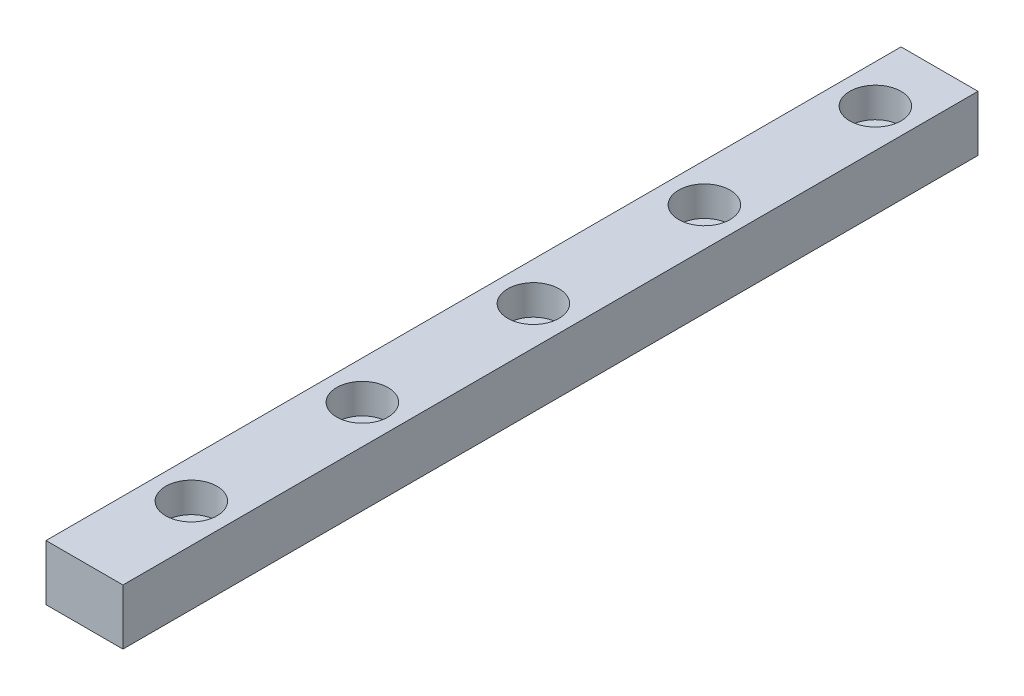
from build123d import *

# Parameters (mm, degrees)
SKETCH_1_W          = 9
SKETCH_1_H          = 6.5
EXTRUDE_1_DEPTH     = 100
SKETCH_2_R          = 1.750000006
CUT_EXTRUDE_1_DEPTH = 90.614230596
SKETCH_3_R          = 3.000000006
CUT_EXTRUDE_2_DEPTH = 3.5


with BuildPart() as part:
    # 草图1 → 凸台-拉伸1 (new body)
    with BuildSketch(Plane.XY.offset(-89.264832522)):
        Rectangle(SKETCH_1_W, SKETCH_1_H)
    extrude(amount=EXTRUDE_1_DEPTH)

    # 草图2 → 切除-拉伸1 (cut, through all)
    with BuildSketch(Plane(origin=(0, 3.25, 0), x_dir=(1, 0, 0), z_dir=(0, 1, 0))):
        with Locations((0, 81.764832522)):
            Circle(SKETCH_2_R)
        with Locations((0, 61.764832522)):
            Circle(SKETCH_2_R)
        with Locations((0, 41.764832522)):
            Circle(SKETCH_2_R)
        with Locations((0, 21.764832522)):
            Circle(SKETCH_2_R)
        with Locations((0, 1.764832522)):
            Circle(SKETCH_2_R)
        with Locations((0, -18.235167478)):
            Circle(SKETCH_2_R)
        with Locations((0, -38.235167478)):
            Circle(SKETCH_2_R)
        with Locations((0, -58.235167478)):
            Circle(SKETCH_2_R)
        with Locations((0, -78.235167478)):
            Circle(SKETCH_2_R)
        with Locations((0, -98.235167478)):
            Circle(SKETCH_2_R)
        with Locations((0, -118.235167478)):
            Circle(SKETCH_2_R)
        with Locations((0, -138.235167478)):
            Circle(SKETCH_2_R)
        with Locations((0, -158.235167478)):
            Circle(SKETCH_2_R)
        with Locations((0, -178.235167478)):
            Circle(SKETCH_2_R)
        with Locations((0, -198.235167478)):
            Circle(SKETCH_2_R)
        with Locations((0, -218.235167478)):
            Circle(SKETCH_2_R)
        with Locations((0, -238.235167478)):
            Circle(SKETCH_2_R)
        with Locations((0, -258.235167478)):
            Circle(SKETCH_2_R)
        with Locations((0, -278.235167478)):
            Circle(SKETCH_2_R)
        with Locations((0, -298.235167478)):
            Circle(SKETCH_2_R)
        with Locations((0, -318.235167478)):
            Circle(SKETCH_2_R)
        with Locations((0, -338.235167478)):
            Circle(SKETCH_2_R)
        with Locations((0, -358.235167478)):
            Circle(SKETCH_2_R)
        with Locations((0, -378.235167478)):
            Circle(SKETCH_2_R)
        with Locations((0, -398.235167478)):
            Circle(SKETCH_2_R)
        with Locations((0, -418.235167478)):
            Circle(SKETCH_2_R)
        with Locations((0, -438.235167478)):
            Circle(SKETCH_2_R)
        with Locations((0, -458.235167478)):
            Circle(SKETCH_2_R)
        with Locations((0, -478.235167478)):
            Circle(SKETCH_2_R)
        with Locations((0, -498.235167478)):
            Circle(SKETCH_2_R)
        with Locations((0, -518.235167478)):
            Circle(SKETCH_2_R)
        with Locations((0, -538.235167478)):
            Circle(SKETCH_2_R)
        with Locations((0, -558.235167478)):
            Circle(SKETCH_2_R)
        with Locations((0, -578.235167478)):
            Circle(SKETCH_2_R)
        with Locations((0, -598.235167478)):
            Circle(SKETCH_2_R)
        with Locations((0, -618.235167478)):
            Circle(SKETCH_2_R)
        with Locations((0, -638.235167478)):
            Circle(SKETCH_2_R)
        with Locations((0, -658.235167478)):
            Circle(SKETCH_2_R)
        with Locations((0, -678.235167478)):
            Circle(SKETCH_2_R)
        with Locations((0, -698.235167478)):
            Circle(SKETCH_2_R)
        with Locations((0, -718.235167478)):
            Circle(SKETCH_2_R)
        with Locations((0, -738.235167478)):
            Circle(SKETCH_2_R)
        with Locations((0, -758.235167478)):
            Circle(SKETCH_2_R)
        with Locations((0, -778.235167478)):
            Circle(SKETCH_2_R)
        with Locations((0, -798.235167478)):
            Circle(SKETCH_2_R)
        with Locations((0, -818.235167478)):
            Circle(SKETCH_2_R)
        with Locations((0, -838.235167478)):
            Circle(SKETCH_2_R)
        with Locations((0, -858.235167478)):
            Circle(SKETCH_2_R)
        with Locations((0, -878.235167478)):
            Circle(SKETCH_2_R)
        with Locations((0, -898.235167478)):
            Circle(SKETCH_2_R)
        with Locations((0, -918.235167478)):
            Circle(SKETCH_2_R)
        with Locations((0, -938.235167478)):
            Circle(SKETCH_2_R)
        with Locations((0, -958.235167478)):
            Circle(SKETCH_2_R)
        with Locations((0, -978.235167478)):
            Circle(SKETCH_2_R)
        with Locations((0, -998.235167478)):
            Circle(SKETCH_2_R)
        with Locations((0, -1018.235167478)):
            Circle(SKETCH_2_R)
        with Locations((0, -1038.235167478)):
            Circle(SKETCH_2_R)
        with Locations((0, -1058.235167478)):
            Circle(SKETCH_2_R)
        with Locations((0, -1078.235167478)):
            Circle(SKETCH_2_R)
        with Locations((0, -1098.235167478)):
            Circle(SKETCH_2_R)
    extrude(amount=-CUT_EXTRUDE_1_DEPTH, mode=Mode.SUBTRACT)

    # 草图3 → 切除-拉伸2 (cut)
    with BuildSketch(Plane(origin=(0, 3.25, 0), x_dir=(1, 0, 0), z_dir=(0, 1, 0))):
        with Locations((0, 81.764832522)):
            Circle(SKETCH_3_R)
        with Locations((0, 61.764832522)):
            Circle(SKETCH_3_R)
        with Locations((0, 41.764832522)):
            Circle(SKETCH_3_R)
        with Locations((0, 21.764832522)):
            Circle(SKETCH_3_R)
        with Locations((0, 1.764832522)):
            Circle(SKETCH_3_R)
        with Locations((0, -18.235167478)):
            Circle(SKETCH_3_R)
        with Locations((0, -38.235167478)):
            Circle(SKETCH_3_R)
        with Locations((0, -58.235167478)):
            Circle(SKETCH_3_R)
        with Locations((0, -78.235167478)):
            Circle(SKETCH_3_R)
        with Locations((0, -98.235167478)):
            Circle(SKETCH_3_R)
        with Locations((0, -118.235167478)):
            Circle(SKETCH_3_R)
        with Locations((0, -138.235167478)):
            Circle(SKETCH_3_R)
        with Locations((0, -158.235167478)):
            Circle(SKETCH_3_R)
        with Locations((0, -178.235167478)):
            Circle(SKETCH_3_R)
        with Locations((0, -198.235167478)):
            Circle(SKETCH_3_R)
        with Locations((0, -218.235167478)):
            Circle(SKETCH_3_R)
        with Locations((0, -238.235167478)):
            Circle(SKETCH_3_R)
        with Locations((0, -258.235167478)):
            Circle(SKETCH_3_R)
        with Locations((0, -278.235167478)):
            Circle(SKETCH_3_R)
        with Locations((0, -298.235167478)):
            Circle(SKETCH_3_R)
        with Locations((0, -318.235167478)):
            Circle(SKETCH_3_R)
        with Locations((0, -338.235167478)):
            Circle(SKETCH_3_R)
        with Locations((0, -358.235167478)):
            Circle(SKETCH_3_R)
        with Locations((0, -378.235167478)):
            Circle(SKETCH_3_R)
        with Locations((0, -398.235167478)):
            Circle(SKETCH_3_R)
        with Locations((0, -418.235167478)):
            Circle(SKETCH_3_R)
        with Locations((0, -438.235167478)):
            Circle(SKETCH_3_R)
        with Locations((0, -458.235167478)):
            Circle(SKETCH_3_R)
        with Locations((0, -478.235167478)):
            Circle(SKETCH_3_R)
        with Locations((0, -498.235167478)):
            Circle(SKETCH_3_R)
        with Locations((0, -518.235167478)):
            Circle(SKETCH_3_R)
        with Locations((0, -538.235167478)):
            Circle(SKETCH_3_R)
        with Locations((0, -558.235167478)):
            Circle(SKETCH_3_R)
        with Locations((0, -578.235167478)):
            Circle(SKETCH_3_R)
        with Locations((0, -598.235167478)):
            Circle(SKETCH_3_R)
        with Locations((0, -618.235167478)):
            Circle(SKETCH_3_R)
        with Locations((0, -638.235167478)):
            Circle(SKETCH_3_R)
        with Locations((0, -658.235167478)):
            Circle(SKETCH_3_R)
        with Locations((0, -678.235167478)):
            Circle(SKETCH_3_R)
        with Locations((0, -698.235167478)):
            Circle(SKETCH_3_R)
        with Locations((0, -718.235167478)):
            Circle(SKETCH_3_R)
        with Locations((0, -738.235167478)):
            Circle(SKETCH_3_R)
        with Locations((0, -758.235167478)):
            Circle(SKETCH_3_R)
        with Locations((0, -778.235167478)):
            Circle(SKETCH_3_R)
        with Locations((0, -798.235167478)):
            Circle(SKETCH_3_R)
        with Locations((0, -818.235167478)):
            Circle(SKETCH_3_R)
        with Locations((0, -838.235167478)):
            Circle(SKETCH_3_R)
        with Locations((0, -858.235167478)):
            Circle(SKETCH_3_R)
        with Locations((0, -878.235167478)):
            Circle(SKETCH_3_R)
        with Locations((0, -898.235167478)):
            Circle(SKETCH_3_R)
        with Locations((0, -918.235167478)):
            Circle(SKETCH_3_R)
        with Locations((0, -938.235167478)):
            Circle(SKETCH_3_R)
        with Locations((0, -958.235167478)):
            Circle(SKETCH_3_R)
        with Locations((0, -978.235167478)):
            Circle(SKETCH_3_R)
        with Locations((0, -998.235167478)):
            Circle(SKETCH_3_R)
        with Locations((0, -1018.235167478)):
            Circle(SKETCH_3_R)
        with Locations((0, -1038.235167478)):
            Circle(SKETCH_3_R)
        with Locations((0, -1058.235167478)):
            Circle(SKETCH_3_R)
        with Locations((0, -1078.235167478)):
            Circle(SKETCH_3_R)
        with Locations((0, -1098.235167478)):
            Circle(SKETCH_3_R)
    extrude(amount=-CUT_EXTRUDE_2_DEPTH, mode=Mode.SUBTRACT)


solid = part.part
